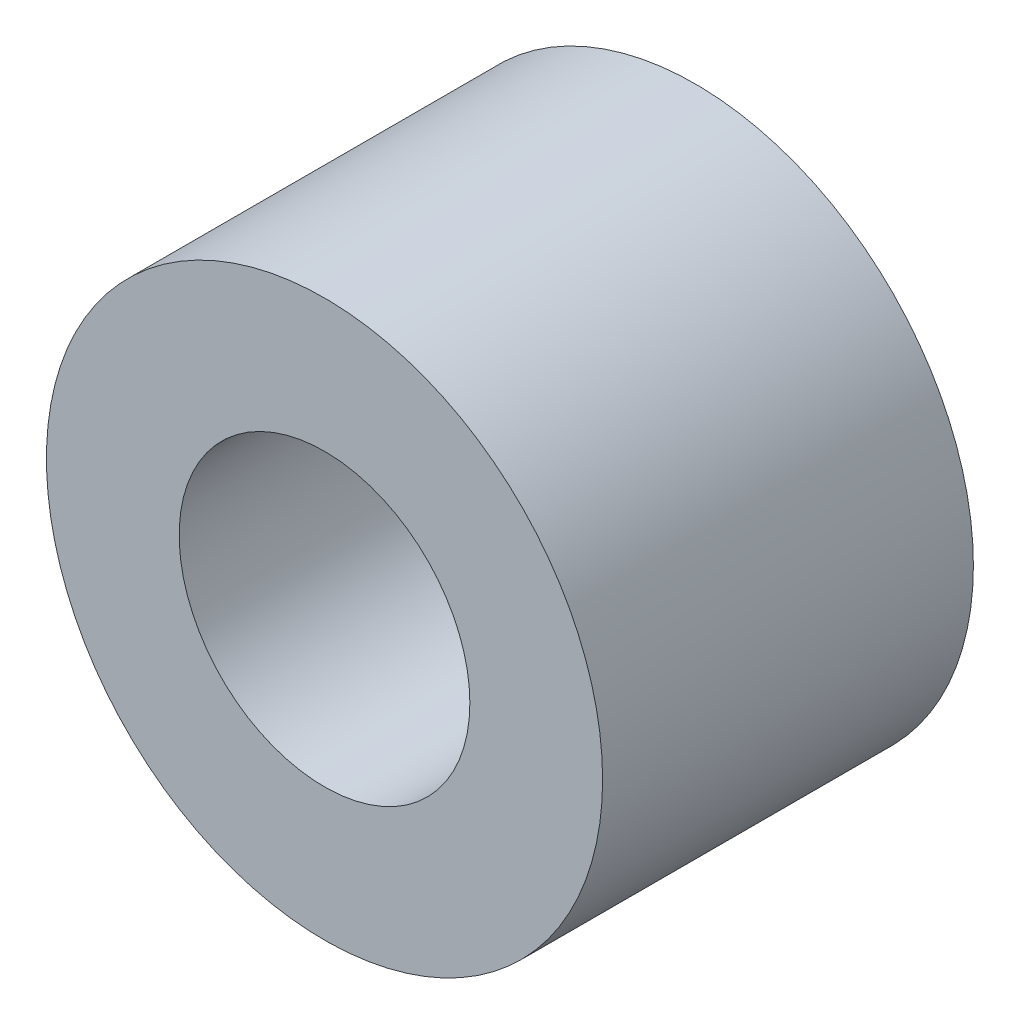
from build123d import *

# Parameters (mm, degrees)
SKETCH1_R           = 4.7625
SKETCH1_R_2         = 2.4892
BOSS_EXTRUDE1_DEPTH = 6.35


with BuildPart() as part:
    # Sketch1 → Boss-Extrude1 (new body)
    with BuildSketch(Plane.XY):
        Circle(SKETCH1_R)
        Circle(SKETCH1_R_2, mode=Mode.SUBTRACT)
    extrude(amount=BOSS_EXTRUDE1_DEPTH)


solid = part.part
